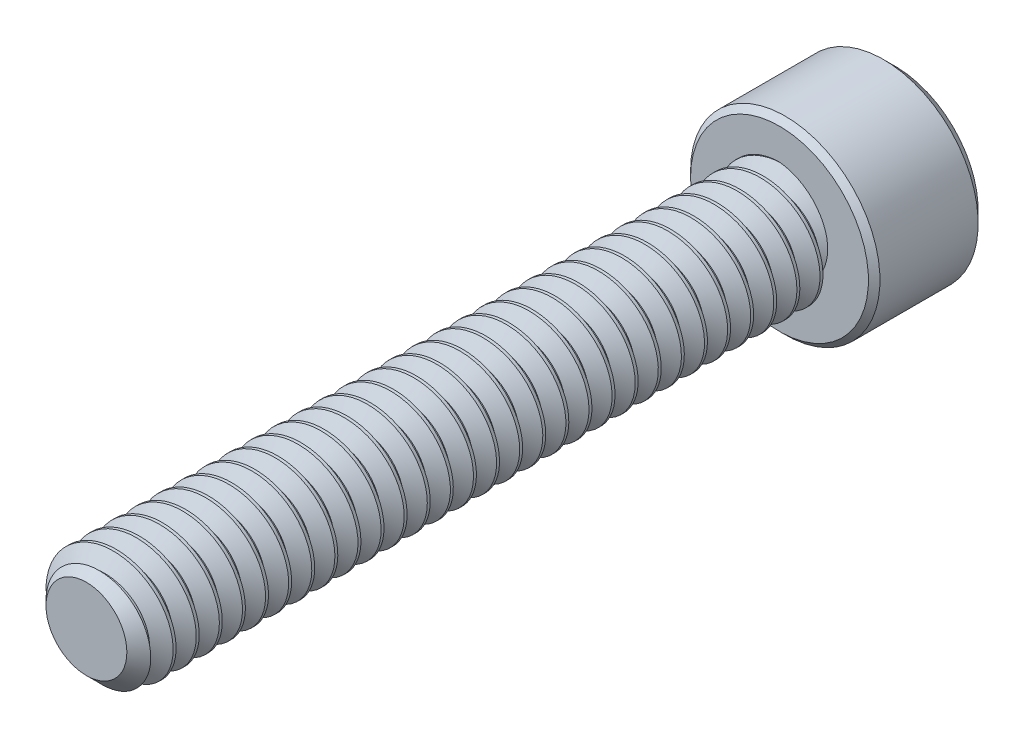
from build123d import *

# Parameters (mm, degrees)
SKETCH1_R          = 1.5875
EXTRUDE1_DEPTH     = 19.05
CHAMFER3_SIZE      = 0.47625
CUT_SWEEP1_PITCH   = 0.635
SKETCH6_R          = 2.6035
EXTRUDE2_DEPTH     = 3.175
CUT_EXTRUDE1_DEPTH = 1.7859375
SKETCH8_R          = 1.374815329
CUT_EXTRUDE2_DEPTH = 0.3175
CUT_EXTRUDE2_DRAFT = -45
CHAMFER1_SIZE      = 0.3175
CHAMFER2_SIZE      = 0.15875


with BuildPart() as part:
    # Sketch1 → Extrude1 (new body)
    with BuildSketch(Plane.XY):
        Circle(SKETCH1_R)
    extrude(amount=-EXTRUDE1_DEPTH)

    # Chamfer3
    chamfer3_edges = [part.edges().sort_by_distance(p)[0] for p in [
        (-1.5875, 0, 0),
    ]]
    chamfer(chamfer3_edges, length=CHAMFER3_SIZE)

    # Cut-Sweep1: arcs per turn and ends read off the stored shape
    # Cut-Sweep1: the profile of Sketch3 profile screwed along a right-hand helix through 32 turns, 6 arcs to a turn; built about Z, then put on its axis
    cut_sweep1_z = Axis((0, 0, 0), (0, 0, 1))
    cut_sweep1_corners = [(1.5878, 0, -0.555798205), (1.175055401, 0, -0.3175), (1.175055401, 0, -0.238125), (1.5878, 0, 0.000173205)]
    with BuildLine(mode=Mode.PRIVATE) as cut_sweep1_profile:
        Line(cut_sweep1_corners[0], cut_sweep1_corners[1])
        Line(cut_sweep1_corners[1], cut_sweep1_corners[2])
        Line(cut_sweep1_corners[2], cut_sweep1_corners[3])
        Line(cut_sweep1_corners[3], cut_sweep1_corners[0])
    cut_sweep1_cap = Face(cut_sweep1_profile.wire())
    cut_sweep1_turn_angles = [0, 30, 60, 90, 120, 150, 180, 210, 240, 270, 300, 330, 360]
    cut_sweep1_turn_weights = [1, 0.8660254037844387, 1, 0.8660254037844387, 1, 0.8660254037844387, 1, 0.8660254037844387, 1, 0.8660254037844387, 1, 0.8660254037844387, 1]
    cut_sweep1_turn_rails = [Edge.make_bspline([Vector(p[0], p[1], 0).rotate(cut_sweep1_z, cut_sweep1_turn_angles[k]) / cut_sweep1_turn_weights[k] + Vector(0, 0, p[2] + CUT_SWEEP1_PITCH * cut_sweep1_turn_angles[k] / 360) for k in range(13)], [0, 0, 0, 1, 1, 2, 2, 3, 3, 4, 4, 5, 5, 6, 6, 6], 2, cut_sweep1_turn_weights) for p in cut_sweep1_corners]
    cut_sweep1_turn_sides = [Face.make_surface_from_curves(cut_sweep1_turn_rails[p[0]], cut_sweep1_turn_rails[p[1]]) for p in [(0, 1), (1, 2), (2, 3), (3, 0)]]
    cut_sweep1 = Plane(origin=(0, 0, 0), x_dir=(0, 1, 0), z_dir=(0, 0, -1)) * Solid(Shell([*[p.moved(Location((0, 0, CUT_SWEEP1_PITCH * i))) for i in range(32) for p in cut_sweep1_turn_sides], cut_sweep1_cap, cut_sweep1_cap.rotate(cut_sweep1_z, 11520).moved(Location((0, 0, CUT_SWEEP1_PITCH * 11520 / 360)))]))
    add(cut_sweep1, mode=Mode.SUBTRACT)

    # Sketch6 → Extrude2 (add)
    with BuildSketch(Plane(origin=(0, 0, -19.05), x_dir=(-1, 0, 0), z_dir=(0, 0, -1))):
        Circle(SKETCH6_R)
    extrude(amount=EXTRUDE2_DEPTH)

    # Sketch7 → Cut-Extrude1 (cut)
    with BuildSketch(Plane(origin=(0, 0, -22.225), x_dir=(-1, 0, 0), z_dir=(0, 0, -1))):
        Polygon((0, 1.374815329), (-1.190625, 0.687407664), (-1.190625, -0.687407664), (0, -1.374815329), (1.190625, -0.687407664), (1.190625, 0.687407664), align=None)
    extrude(amount=-CUT_EXTRUDE1_DEPTH, mode=Mode.SUBTRACT)


with BuildPart() as cut_extrude2_tool:
    # Sketch8 → Cut-Extrude2 (with draft: the straight prism first)
    with BuildSketch(Plane(origin=(0, 0, -22.225), x_dir=(-1, 0, 0), z_dir=(0, 0, -1))):
        Circle(SKETCH8_R)
    extrude(amount=-CUT_EXTRUDE2_DEPTH)
    # Cut-Extrude2: the draft: its side faces are tilted about the plane it starts from
    cut_extrude2_sides = [cut_extrude2_tool.faces().sort_by_distance(p)[0] for p in [
        (1.374815329, 0, -22.06625),
    ]]
    draft(cut_extrude2_sides, Plane(origin=(0, 0, -22.225), x_dir=(-1, 0, 0), z_dir=(0, 0, -1)), CUT_EXTRUDE2_DRAFT)


with BuildPart() as part_1:
    add(part.part)

    # Cut-Extrude2: cut by cut_extrude2_tool
    add(cut_extrude2_tool.part, mode=Mode.SUBTRACT)

    # Chamfer1
    chamfer1_edges = [part_1.edges().sort_by_distance(p)[0] for p in [
        (2.6035, 0, -22.225),
    ]]
    chamfer(chamfer1_edges, length=CHAMFER1_SIZE)

    # Chamfer2
    chamfer2_edges = [part_1.edges().sort_by_distance(p)[0] for p in [
        (2.6035, 0, -19.05),
    ]]
    chamfer(chamfer2_edges, length=CHAMFER2_SIZE)


solid = part_1.part
